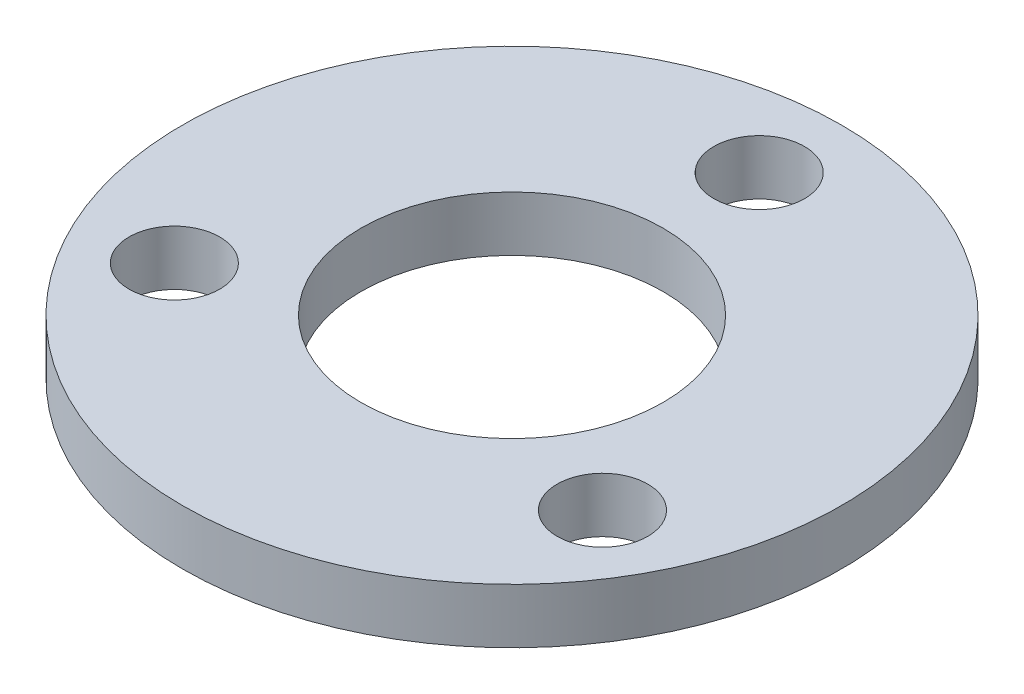
from build123d import *

# Parameters (mm, degrees)
SKETCH_1_R      = 12
SKETCH_1_R_2    = 1.65
SKETCH_1_R_3    = 5.5
EXTRUDE_1_DEPTH = 2


with BuildPart() as part:
    # Эскиз1 → Бобышка-Вытянуть1 (new body)
    with BuildSketch(Plane(origin=(0, 0, 0), x_dir=(1, 0, 0), z_dir=(0, 1, 0))):
        Circle(SKETCH_1_R)
        with Locations((0, 9)):
            Circle(SKETCH_1_R_2, mode=Mode.SUBTRACT)
        with Locations((7.794228634, -4.5)):
            Circle(SKETCH_1_R_2, mode=Mode.SUBTRACT)
        with Locations((-7.794228634, -4.5)):
            Circle(SKETCH_1_R_2, mode=Mode.SUBTRACT)
        Circle(SKETCH_1_R_3, mode=Mode.SUBTRACT)
    extrude(amount=EXTRUDE_1_DEPTH)


solid = part.part
